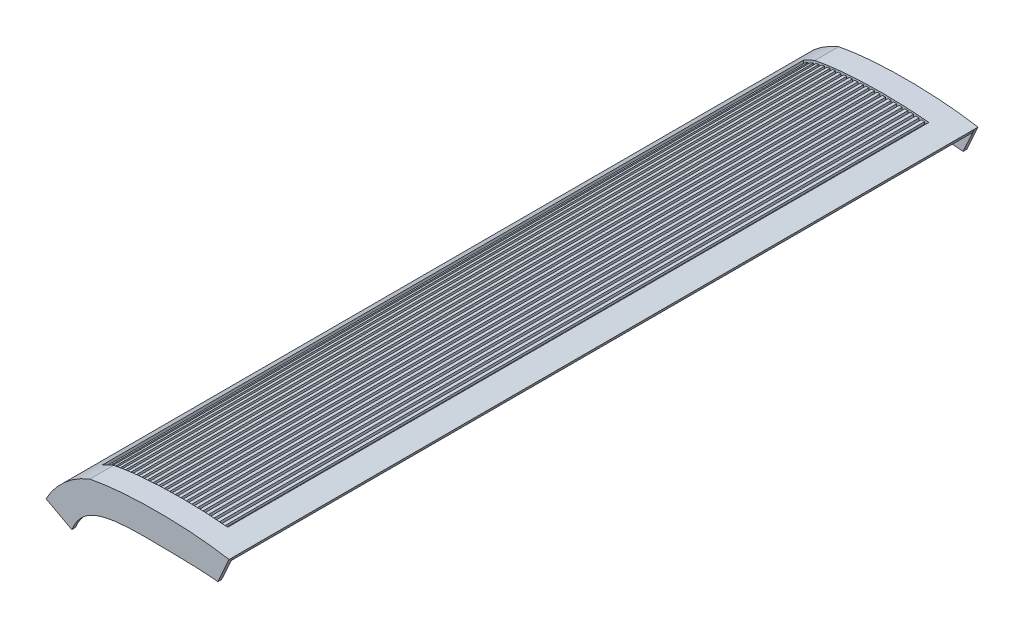
from build123d import *

# Parameters (mm, degrees)
ESTRUSIONE_ESTRUSIONE1_DEPTH  = 734.65
TAGLIO_ESTRUSIONE2_DEPTH      = 769.417610807
SCHIZZO4_W                    = 124.4
SCHIZZO4_H                    = 694.65
TAGLIO_ESTRUSIONE4_DEPTH      = 150
ESTRUSIONE_ESTRUSIONE2_START  = -3.65
ESTRUSIONE_ESTRUSIONE2_DEPTH  = 3.65
ESTRUSIONE_ESTRUSIONE3_DEPTH  = 694.65
TAGLIO_ESTRUSIONE5_REACH      = 777.4
ESTRUSIONE_ESTRUSIONE5_START  = 718.95
ESTRUSIONE_ESTRUSIONE5_DEPTH  = 4
TAGLIO_ESTRUSIONE6_DEPTH      = 4
ESTRUSIONE_ESTRUSIONE8_DEPTH  = 4
ESTRUSIONE_ESTRUSIONE10_START = 15
ESTRUSIONE_ESTRUSIONE10_DEPTH = 4
TAGLIO_ESTRUSIONE7_DEPTH      = 8
ESTRUSIONE_ESTRUSIONE11_DEPTH = 4
ESTRUSIONE_ESTRUSIONE12_START = 364.8
ESTRUSIONE_ESTRUSIONE12_DEPTH = 5
TAGLIO_ESTRUSIONE8_DEPTH      = 5
ESTRUSIONE_ESTRUSIONE13_DEPTH = 5


with BuildPart() as part:
    # Schizzo1 → Estrusione-Estrusione1 (new body)
    with BuildSketch(Plane.XY):
        with BuildLine():
            Line((12.6, 70.4), (17.008835812, 68.04157536))
            ThreePointArc((17.008835812, 68.04157536), (20.932511807, 75.458327557), (26.5, 81.735788961))
            add(Edge.make_bspline(
                [(107.734400105, 104.542752294), (80.106638678, 101.01174599), (49.253448125, 100.153815002), (26.5, 81.735788961)],
                knots=[0, 0, 0, 0, 1, 1, 1, 1], degree=3))
            Line((107.734400105, 104.542752294), (191.734400105, 104.542752294))
            Line((191.734400105, 104.542752294), (194, 109))
            add(Edge.make_bspline(
                [(194, 109), (151.502192325, 116.474922632), (92.222016094, 116.293081601), (56, 109)],
                knots=[0, 0, 0, 0, 1, 1, 1, 1], degree=3))
            ThreePointArc((56, 109), (30.861042629, 93.566599739), (12.6, 70.4))
        make_face()
    extrude(amount=ESTRUSIONE_ESTRUSIONE1_DEPTH)

    # Schizzo2 → Taglio-Estrusione2 (cut, through all)
    with BuildSketch(Plane(origin=(0, 0, 0), x_dir=(-1, 0, 0), z_dir=(0, 0, -1))):
        with BuildLine():
            Line((-107.734400105, 104.542752294), (-191.734400105, 104.542752294))
            Line((-191.734400105, 104.542752294), (-191.960960094, 104.988477064))
            add(Edge.make_bspline(
                [(-191.960960094, 104.988477064), (-159.69978445, 110.70910623), (-111.22857668, 111.841827465), (-58.177617149, 107.879010001), (-37.124424853, 95.517478461), (-25.136316921, 83.040429537)],
                knots=[0, 0, 0, 0, 0.528175519, 0.738646854, 1, 1, 1, 1], degree=3))
            add(Edge.make_bspline(
                [(-25.136316921, 83.040429537), (-20.463853153, 75.880867163), (-16.127068649, 68.513260288)],
                knots=[0, 0, 0, 1, 1, 1], degree=2))
            Line((-16.127068649, 68.513260288), (-17.008835812, 68.04157536))
            Line((-17.008835812, 68.04157536), (-107.734400105, 104.542752294))
        make_face()
    extrude(amount=-TAGLIO_ESTRUSIONE2_DEPTH, mode=Mode.SUBTRACT)

    # Schizzo4 → Taglio-Estrusione4 (cut)
    with BuildSketch(Plane(origin=(0, 0, 0), x_dir=(1, 0, 0), z_dir=(0, 1, 0))):
        with Locations((106.8, -367.325)):
            Rectangle(SCHIZZO4_W, SCHIZZO4_H)
    extrude(amount=TAGLIO_ESTRUSIONE4_DEPTH, mode=Mode.SUBTRACT)

    # Schizzo6 → Estrusione-Estrusione2 (add)
    with BuildSketch(Plane.XY.offset(ESTRUSIONE_ESTRUSIONE2_START)):
        with BuildLine():
            ThreePointArc((25.136316921, 83.040429537), (20.547787769, 75.828879903), (16.127068649, 68.513260288))
            Line((16.127068649, 68.513260288), (38.171247708, 56.721137086))
            add(Edge.make_bspline(
                [(182.9, 84.4), (162.548484893, 85.986053841), (129.902109928, 85.590941508), (70.420343506, 87.306518443), (45.606906259, 73.175039094), (38.171247708, 56.721137086)],
                knots=[0, 0, 0, 0, 0.380128931, 0.71393385, 1, 1, 1, 1], degree=3))
            Line((182.9, 84.4), (194, 109))
            Line((194, 109), (191.960960094, 104.988477064))
            add(Edge.make_bspline(
                [(25.136316921, 83.040429537), (37.124424853, 95.517478461), (58.177617149, 107.879010001), (111.22857668, 111.841827465), (159.69978445, 110.70910623), (191.960960094, 104.988477064)],
                knots=[0, 0, 0, 0, 0.261353146, 0.471824481, 1, 1, 1, 1], degree=3))
        make_face()
        with BuildLine():
            ThreePointArc((56, 109), (30.861042629, 93.566599739), (12.6, 70.4))
            Line((12.6, 70.4), (16.127068649, 68.513260288))
            ThreePointArc((16.127068649, 68.513260288), (20.547787769, 75.828879903), (25.136316921, 83.040429537))
            add(Edge.make_bspline(
                [(25.136316921, 83.040429537), (37.124424853, 95.517478461), (58.177617149, 107.879010001), (111.22857668, 111.841827465), (159.69978445, 110.70910623), (191.960960094, 104.988477064)],
                knots=[0, 0, 0, 0, 0.261353146, 0.471824481, 1, 1, 1, 1], degree=3))
            Line((191.960960094, 104.988477064), (194, 109))
            add(Edge.make_bspline(
                [(194, 109), (151.502192325, 116.474922632), (92.222016094, 116.293081601), (56, 109)],
                knots=[0, 0, 0, 0, 1, 1, 1, 1], degree=3))
        make_face()
    estrusione_estrusione2 = extrude(amount=ESTRUSIONE_ESTRUSIONE2_DEPTH)

    # Specchia1: Estrusione-Estrusione2 across plane
    add(estrusione_estrusione2.mirror(Plane(origin=(0, 0, 367.325), x_dir=(1, 0, 0), z_dir=(0, 0, -1))))

    # Schizzo8 → Estrusione-Estrusione3 (add)
    with BuildSketch(Plane.XY.offset(20)):
        with BuildLine():
            add(Edge.make_bspline(
                [(46.10000001, 102.075729944), (47.078190617, 102.66425108), (48.078995211, 103.211118633), (49.10000001, 103.719786713)],
                knots=[0.014357574, 0.014357574, 0.014357574, 0.014357574, 0.042104262, 0.042104262, 0.042104262, 0.042104262], degree=3))
            Line((46.10000001, 102.075729944), (46.10000001, 97.938998712))
            add(Edge.make_bspline(
                [(46.10000001, 97.938998712), (47.147355804, 98.41106095), (48.146057386, 98.853288802), (49.10000001, 99.267943558)],
                knots=[0.146243585, 0.146243585, 0.146243585, 0.146243585, 0.155879741, 0.155879741, 0.155879741, 0.155879741], degree=3))
            Line((49.10000001, 99.267943558), (49.10000001, 103.719786713))
        make_face()
        with BuildLine():
            add(Edge.make_bspline(
                [(51.60000001, 104.874162222), (52.584660371, 105.294911256), (53.585320287, 105.684622331), (54.60000001, 106.046128457)],
                knots=[0.064407479, 0.064407479, 0.064407479, 0.064407479, 0.090380054, 0.090380054, 0.090380054, 0.090380054], degree=3))
            Line((51.60000001, 104.874162222), (51.60000001, 100.334826866))
            add(Edge.make_bspline(
                [(51.60000001, 100.334826866), (52.657862151, 100.777343762), (53.655572277, 101.182620852), (54.60000001, 101.554646123)],
                knots=[0.164663301, 0.164663301, 0.164663301, 0.164663301, 0.176305534, 0.176305534, 0.176305534, 0.176305534], degree=3))
            Line((54.60000001, 101.554646123), (54.60000001, 106.046128457))
        make_face()
        with BuildLine():
            add(Edge.make_bspline(
                [(57.10000001, 106.872964552), (58.089261053, 107.176136343), (59.089835363, 107.455696593), (60.10000001, 107.714110811)],
                knots=[0.111482891, 0.111482891, 0.111482891, 0.111482891, 0.136280007, 0.136280007, 0.136280007, 0.136280007], degree=3))
            Line((57.10000001, 106.872964552), (57.10000001, 102.508705325))
            add(Edge.make_bspline(
                [(57.10000001, 102.508705325), (58.169471517, 102.902751174), (59.164932088, 103.250170607), (60.10000001, 103.558869377)],
                knots=[0.187122658, 0.187122658, 0.187122658, 0.187122658, 0.20174778, 0.20174778, 0.20174778, 0.20174778], degree=3))
            Line((60.10000001, 103.558869377), (60.10000001, 107.714110811))
        make_face()
        with BuildLine():
            add(Edge.make_bspline(
                [(62.60000001, 108.307765345), (63.592843848, 108.526188353), (64.593366218, 108.726655654), (65.60000001, 108.911409777)],
                knots=[0.15658621, 0.15658621, 0.15658621, 0.15658621, 0.180612046, 0.180612046, 0.180612046, 0.180612046], degree=3))
            Line((62.60000001, 108.307765345), (62.60000001, 104.336787861))
            add(Edge.make_bspline(
                [(62.60000001, 104.336787861), (63.668614399, 104.647955911), (64.659034603, 104.907706587), (65.60000001, 105.132723818)],
                knots=[0.215564929, 0.215564929, 0.215564929, 0.215564929, 0.234324281, 0.234324281, 0.234324281, 0.234324281], degree=3))
            Line((65.60000001, 105.132723818), (65.60000001, 108.911409777))
        make_face()
        with BuildLine():
            add(Edge.make_bspline(
                [(68.10000001, 109.337374659), (69.095858287, 109.494631833), (70.096350723, 109.638558587), (71.10000001, 109.771268943)],
                knots=[0.200409567, 0.200409567, 0.200409567, 0.200409567, 0.223967415, 0.223967415, 0.223967415, 0.223967415], degree=3))
            Line((68.10000001, 109.337374659), (68.10000001, 105.679796553))
            add(Edge.make_bspline(
                [(68.10000001, 105.679796553), (68.553250449, 105.770602802), (69.557807936, 105.962952301), (70.551444712, 106.140786664), (71.10000001, 106.2352491)],
                knots=[0.251626746, 0.251626746, 0.251626746, 0.251626746, 0.261353146, 0.273481208, 0.273481208, 0.273481208, 0.273481208], degree=3))
            Line((71.10000001, 106.2352491), (71.10000001, 109.771268943))
        make_face()
        with BuildLine():
            add(Edge.make_bspline(
                [(73.60000001, 110.079199072), (74.598581398, 110.193711697), (75.59906035, 110.298932813), (76.60000001, 110.396918557)],
                knots=[0.243483293, 0.243483293, 0.243483293, 0.243483293, 0.266824126, 0.266824126, 0.266824126, 0.266824126], degree=3))
            Line((73.60000001, 110.079199072), (73.60000001, 106.640089643))
            add(Edge.make_bspline(
                [(73.60000001, 106.640089643), (74.606151932, 106.792784262), (75.605073124, 106.932151748), (76.60000001, 107.059761944)],
                knots=[0.292040247, 0.292040247, 0.292040247, 0.292040247, 0.314596862, 0.314596862, 0.314596862, 0.314596862], degree=3))
            Line((76.60000001, 107.059761944), (76.60000001, 110.396918557))
        make_face()
        with BuildLine():
            add(Edge.make_bspline(
                [(79.10000001, 110.627782843), (80.101215916, 110.715190707), (81.101695594, 110.797069373), (82.10000001, 110.87547809)],
                knots=[0.286255559, 0.286255559, 0.286255559, 0.286255559, 0.30960817, 0.30960817, 0.30960817, 0.30960817], degree=3))
            Line((79.10000001, 110.627782843), (79.10000001, 107.357307576))
            add(Edge.make_bspline(
                [(79.10000001, 107.357307576), (80.100190775, 107.467344036), (81.099079994, 107.566736267), (82.10000001, 107.657100634)],
                knots=[0.333539265, 0.333539265, 0.333539265, 0.333539265, 0.356316552, 0.356316552, 0.356316552, 0.356316552], degree=3))
            Line((82.10000001, 107.657100634), (82.10000001, 110.87547809))
        make_face()
        with BuildLine():
            add(Edge.make_bspline(
                [(84.60000001, 111.066125055), (85.602769117, 111.14066118), (86.602633438, 111.212799576), (87.60000001, 111.282477116)],
                knots=[0.329143574, 0.329143574, 0.329143574, 0.329143574, 0.352706737, 0.352706737, 0.352706737, 0.352706737], degree=3))
            Line((84.60000001, 111.066125055), (84.60000001, 107.864496334))
            add(Edge.make_bspline(
                [(84.60000001, 107.864496334), (85.594248143, 107.940041876), (86.593177727, 108.008089337), (87.60000001, 108.070196346)],
                knots=[0.37523382, 0.37523382, 0.37523382, 0.37523382, 0.397731791, 0.397731791, 0.397731791, 0.397731791], degree=3))
            Line((87.60000001, 108.070196346), (87.60000001, 111.282477116))
        make_face()
        with BuildLine():
            add(Edge.make_bspline(
                [(90.10000001, 111.452269513), (91.102055197, 111.518348466), (92.10191597, 111.581870078), (93.10000001, 111.642769572)],
                knots=[0.372434034, 0.372434034, 0.372434034, 0.372434034, 0.396200831, 0.396200831, 0.396200831, 0.396200831], degree=3))
            Line((90.10000001, 111.452269513), (90.10000001, 108.212144079))
            add(Edge.make_bspline(
                [(90.10000001, 108.212144079), (91.089162876, 108.263825538), (92.088192255, 108.311140964), (93.10000001, 108.355502772)],
                knots=[0.416220674, 0.416220674, 0.416220674, 0.416220674, 0.437996557, 0.437996557, 0.437996557, 0.437996557], degree=3))
            Line((93.10000001, 108.355502772), (93.10000001, 111.642769572))
        make_face()
        with BuildLine():
            add(Edge.make_bspline(
                [(95.60000001, 111.789986137), (96.601302768, 111.846790243), (97.601161051, 111.900886262), (98.60000001, 111.952208258)],
                knots=[0.416072153, 0.416072153, 0.416072153, 0.416072153, 0.439979768, 0.439979768, 0.439979768, 0.439979768], degree=3))
            Line((95.60000001, 111.789986137), (95.60000001, 108.458810799))
            add(Edge.make_bspline(
                [(95.60000001, 108.458810799), (96.364283773, 108.488720342), (97.360372867, 108.526015513), (98.372159413, 108.562621615), (98.60000001, 108.570797013)],
                knots=[0.455737521, 0.455737521, 0.455737521, 0.455737521, 0.471824481, 0.476479218, 0.476479218, 0.476479218, 0.476479218], degree=3))
            Line((98.60000001, 108.570797013), (98.60000001, 111.952208258))
        make_face()
        with BuildLine():
            add(Edge.make_bspline(
                [(101.10000001, 112.074919435), (102.100525449, 112.121707837), (103.10038241, 112.165649595), (104.10000001, 112.206678159)],
                knots=[0.459940973, 0.459940973, 0.459940973, 0.459940973, 0.483922706, 0.483922706, 0.483922706, 0.483922706], degree=3))
            Line((101.10000001, 112.074919435), (101.10000001, 108.657643408))
            add(Edge.make_bspline(
                [(101.10000001, 108.657643408), (102.08688281, 108.690741472), (103.087121841, 108.722819729), (104.10000001, 108.75351227)],
                knots=[0.493298743, 0.493298743, 0.493298743, 0.493298743, 0.512983566, 0.512983566, 0.512983566, 0.512983566], degree=3))
            Line((104.10000001, 108.75351227), (104.10000001, 112.206678159))
        make_face()
        with BuildLine():
            add(Edge.make_bspline(
                [(106.60000001, 112.3031855), (107.599738413, 112.339318145), (108.599595279, 112.372480794), (109.60000001, 112.402606849)],
                knots=[0.503917132, 0.503917132, 0.503917132, 0.503917132, 0.527904183, 0.527904183, 0.527904183, 0.527904183], degree=3))
            Line((106.60000001, 112.3031855), (106.60000001, 108.825561112))
            add(Edge.make_bspline(
                [(106.60000001, 108.825561112), (107.589156327, 108.852556891), (108.589366199, 108.878008768), (109.60000001, 108.90159547)],
                knots=[0.529018536, 0.529018536, 0.529018536, 0.529018536, 0.547867991, 0.547867991, 0.547867991, 0.547867991], degree=3))
            Line((109.60000001, 108.90159547), (109.60000001, 112.402606849))
        make_face()
        with BuildLine():
            add(Edge.make_bspline(
                [(112.10000001, 112.471500117), (113.099340464, 112.496473532), (114.099363336, 112.51837769), (115.10000001, 112.537167574)],
                knots=[0.547874562, 0.547874562, 0.547874562, 0.547874562, 0.571809471, 0.571809471, 0.571809471, 0.571809471], degree=3))
            Line((112.10000001, 112.471500117), (112.10000001, 108.955543927))
            add(Edge.make_bspline(
                [(112.10000001, 108.955543927), (113.090967195, 108.975147187), (114.091155599, 108.992770248), (115.10000001, 109.008124701)],
                knots=[0.563282713, 0.563282713, 0.563282713, 0.563282713, 0.58146619, 0.58146619, 0.58146619, 0.58146619], degree=3))
            Line((115.10000001, 109.008124701), (115.10000001, 112.537167574))
        make_face()
        with BuildLine():
            add(Edge.make_bspline(
                [(117.60000001, 112.577589802), (118.599468432, 112.591134867), (119.599491158, 112.601541654), (120.60000001, 112.608765433)],
                knots=[0.59173268, 0.59173268, 0.59173268, 0.59173268, 0.615616389, 0.615616389, 0.615616389, 0.615616389], degree=3))
            Line((117.60000001, 112.577589802), (117.60000001, 109.041173631))
            add(Edge.make_bspline(
                [(117.60000001, 109.041173631), (118.592456724, 109.052273972), (119.59262892, 109.061014928), (120.60000001, 109.067132899)],
                knots=[0.596383122, 0.596383122, 0.596383122, 0.596383122, 0.614029464, 0.614029464, 0.614029464, 0.614029464], degree=3))
            Line((120.60000001, 109.067132899), (120.60000001, 112.608765433))
        make_face()
        with BuildLine():
            add(Edge.make_bspline(
                [(123.10000001, 112.620163491), (124.099594698, 112.622052842), (125.09961731, 112.620732718), (126.10000001, 112.616158614)],
                knots=[0.635501627, 0.635501627, 0.635501627, 0.635501627, 0.659345348, 0.659345348, 0.659345348, 0.659345348], degree=3))
            Line((123.10000001, 112.620163491), (123.10000001, 109.07675891))
            add(Edge.make_bspline(
                [(123.10000001, 109.07675891), (124.093716032, 109.078343663), (125.09387579, 109.077227079), (126.10000001, 109.073164599)],
                knots=[0.628543516, 0.628543516, 0.628543516, 0.628543516, 0.645754308, 0.645754308, 0.645754308, 0.645754308], degree=3))
            Line((126.10000001, 109.073164599), (126.10000001, 112.616158614))
        make_face()
        with BuildLine():
            add(Edge.make_bspline(
                [(128.60000001, 112.59793518), (129.599719683, 112.587922702), (130.599742213, 112.57462717), (131.60000001, 112.558004243)],
                knots=[0.679201874, 0.679201874, 0.679201874, 0.679201874, 0.703016636, 0.703016636, 0.703016636, 0.703016636], degree=3))
            Line((128.60000001, 112.59793518), (128.60000001, 109.056975984))
            add(Edge.make_bspline(
                [(128.60000001, 109.056975984), (129.594806806, 109.048076888), (130.594956937, 109.036158054), (131.60000001, 109.020989663)],
                knots=[0.659941536, 0.659941536, 0.659941536, 0.659941536, 0.676799429, 0.676799429, 0.676799429, 0.676799429], degree=3))
            Line((131.60000001, 109.020989663), (131.60000001, 112.558004243))
        make_face()
        with BuildLine():
            add(Edge.make_bspline(
                [(134.10000001, 112.50951349), (135.099843793, 112.487333402), (136.099866272, 112.461794083), (137.10000001, 112.432851292)],
                knots=[0.722853579, 0.722853579, 0.722853579, 0.722853579, 0.746650275, 0.746650275, 0.746650275, 0.746650275], degree=3))
            Line((134.10000001, 112.50951349), (134.10000001, 108.976626858))
            add(Edge.make_bspline(
                [(134.10000001, 108.976626858), (135.095772623, 108.956282239), (136.0959153, 108.932613045), (137.10000001, 108.905400864)],
                knots=[0.690722618, 0.690722618, 0.690722618, 0.690722618, 0.707296796, 0.707296796, 0.707296796, 0.707296796], degree=3))
            Line((137.10000001, 108.905400864), (137.10000001, 112.432851292))
        make_face()
        with BuildLine():
            add(Edge.make_bspline(
                [(139.60000001, 112.353396399), (140.599967428, 112.318762199), (141.599989886, 112.280689761), (142.60000001, 112.239134885)],
                knots=[0.766476674, 0.766476674, 0.766476674, 0.766476674, 0.790266116, 0.790266116, 0.790266116, 0.790266116], degree=3))
            Line((139.60000001, 112.353396399), (139.60000001, 108.830460924))
            add(Edge.make_bspline(
                [(139.60000001, 108.830460924), (140.596645496, 108.797686267), (141.59678246, 108.761288001), (142.60000001, 108.721056463)],
                knots=[0.721009218, 0.721009218, 0.721009218, 0.721009218, 0.737359156, 0.737359156, 0.737359156, 0.737359156], degree=3))
            Line((142.60000001, 108.721056463), (142.60000001, 112.239134885))
        make_face()
        with BuildLine():
            add(Edge.make_bspline(
                [(145.10000001, 112.127965168), (146.100090979, 112.080568416), (147.100113447, 112.029651346), (148.10000001, 111.975169738)],
                knots=[0.810090963, 0.810090963, 0.810090963, 0.810090963, 0.833883931, 0.833883931, 0.833883931, 0.833883931], degree=3))
            Line((145.10000001, 112.127965168), (145.10000001, 108.613029913))
            add(Edge.make_bspline(
                [(145.10000001, 108.613029913), (146.09744987, 108.566792629), (147.097582563, 108.516632092), (148.10000001, 108.462345178)],
                knots=[0.750907204, 0.750907204, 0.750907204, 0.750907204, 0.767085363, 0.767085363, 0.767085363, 0.767085363], degree=3))
            Line((148.10000001, 108.462345178), (148.10000001, 111.975169738))
        make_face()
        with BuildLine():
            add(Edge.make_bspline(
                [(150.60000001, 111.831477369), (151.60021484, 111.77098631), (152.600237349, 111.706889515), (153.60000001, 111.639142683)],
                knots=[0.85371621, 0.85371621, 0.85371621, 0.85371621, 0.877523498, 0.877523498, 0.877523498, 0.877523498], degree=3))
            Line((150.60000001, 111.831477369), (150.60000001, 108.318557925))
            add(Edge.make_bspline(
                [(150.60000001, 108.318557925), (151.59820517, 108.257753619), (152.598334827, 108.192720131), (153.60000001, 108.12325898)],
                knots=[0.780510481, 0.780510481, 0.780510481, 0.780510481, 0.79656432, 0.79656432, 0.79656432, 0.79656432], degree=3))
            Line((153.60000001, 108.12325898), (153.60000001, 111.639142683))
        make_face()
        with BuildLine():
            add(Edge.make_bspline(
                [(156.10000001, 111.46205896), (157.100339406, 111.388116953), (158.100361986, 111.31048017), (159.10000001, 111.229104168)],
                knots=[0.897372227, 0.897372227, 0.897372227, 0.897372227, 0.921204697, 0.921204697, 0.921204697, 0.921204697], degree=3))
            Line((156.10000001, 111.46205896), (156.10000001, 107.940814093))
            add(Edge.make_bspline(
                [(156.10000001, 107.940814093), (157.098927522, 107.864242321), (158.099055243, 107.78312378), (159.10000001, 107.697262955)],
                knots=[0.809904478, 0.809904478, 0.809904478, 0.809904478, 0.825878027, 0.825878027, 0.825878027, 0.825878027], degree=3))
            Line((159.10000001, 107.697262955), (159.10000001, 111.229104168))
        make_face()
        with BuildLine():
            add(Edge.make_bspline(
                [(161.60000001, 111.017695283), (162.600465079, 110.929919024), (163.600487762, 110.838355017), (164.60000001, 110.742958619)],
                knots=[0.941078968, 0.941078968, 0.941078968, 0.941078968, 0.964947594, 0.964947594, 0.964947594, 0.964947594], degree=3))
            Line((161.60000001, 111.017695283), (161.60000001, 107.472978028))
            add(Edge.make_bspline(
                [(161.60000001, 107.472978028), (162.599630972, 107.3793158), (163.599757775, 107.280772155), (164.60000001, 107.177152983)],
                knots=[0.839168901, 0.839168901, 0.839168901, 0.839168901, 0.855104061, 0.855104061, 0.855104061, 0.855104061], degree=3))
            Line((164.60000001, 107.177152983), (164.60000001, 110.742958619))
        make_face()
        with BuildLine():
            add(Edge.make_bspline(
                [(166.60000001, 110.546874027), (167.266921252, 110.479747659), (167.933594672, 110.410899328), (168.60000001, 110.340315743)],
                knots=[0.980873364, 0.980873364, 0.980873364, 0.980873364, 0.996810971, 0.996810971, 0.996810971, 0.996810971], degree=3))
            Line((166.60000001, 110.546874027), (166.60000001, 106.963147816))
            add(Edge.make_bspline(
                [(166.60000001, 106.963147816), (167.26676561, 106.889506288), (167.933469838, 106.813551835), (168.60000001, 106.735226958)],
                knots=[0.865724709, 0.865724709, 0.865724709, 0.865724709, 0.876347313, 0.876347313, 0.876347313, 0.876347313], degree=3))
            Line((168.60000001, 106.735226958), (168.60000001, 110.340315743))
        make_face()
    extrude(amount=ESTRUSIONE_ESTRUSIONE3_DEPTH)

    # Taglio-Estrusione5: up to this face of the body (flat: up to its plane)
    taglio_estrusione5_end = Plane(part.part.faces().sort_by_distance((100.600951379, 94.723507219, -3.65))[0])
    # Schizzo9 → Taglio-Estrusione5 (cut, up to the picked face)
    with BuildSketch(Plane.XY.offset(738.3), mode=Mode.PRIVATE) as taglio_estrusione5_sk1:
        with BuildLine():
            add(Edge.make_bspline(
                [(38.171247708, 56.721137086), (45.05902945, 73.821016737), (70.988744913, 87.670922677), (130.154860637, 86.347718811), (162.243789984, 86.453808975), (182.9, 84.4)],
                knots=[0, 0, 0, 0, 0.28606615, 0.619871069, 1, 1, 1, 1], degree=3))
            add(Edge.make_bspline(
                [(38.171247708, 56.721137086), (45.606906259, 73.175039094), (70.420343506, 87.306518443), (129.902109928, 85.590941508), (162.548484893, 85.986053841), (182.9, 84.4)],
                knots=[0, 0, 0, 0, 0.28606615, 0.619871069, 1, 1, 1, 1], degree=3))
        make_face()
    taglio_estrusione5_tool1 = split(extrude(taglio_estrusione5_sk1.sketch, amount=-TAGLIO_ESTRUSIONE5_REACH, mode=Mode.PRIVATE), bisect_by=taglio_estrusione5_end, keep=Keep.BOTH, mode=Mode.PRIVATE)
    add(taglio_estrusione5_tool1.solids().sort_by(Axis((104.730129, 86.588646, 738.3), (0, 0, -1)))[0], mode=Mode.SUBTRACT)

    # Estrusione-Estrusione5: read off the stored shape, not the designer's step
    # Estrusione-Estrusione5 outline → Estrusione-Estrusione5 (add)
    with BuildSketch(Plane.XY.offset(ESTRUSIONE_ESTRUSIONE5_START)):
        with BuildLine():
            Line((168.260960094, 108.314624021), (168.260960094, 100.314624021))
            add(Edge.make_bspline(
                [(168.260960094, 100.314624021), (170.598511999, 100.065771904), (172.932691736, 99.795720177), (175.260960094, 99.503461558)],
                knots=[0.8724042, 0.8724042, 0.8724042, 0.8724042, 0.909814059, 0.909814059, 0.909814059, 0.909814059], degree=3))
            Line((175.260960094, 99.503461558), (175.260960094, 107.503461558))
            add(Edge.make_bspline(
                [(168.260960094, 108.314624021), (170.598511999, 108.065771904), (172.932691736, 107.795720177), (175.260960094, 107.503461558)],
                knots=[0.8724042, 0.8724042, 0.8724042, 0.8724042, 0.909814059, 0.909814059, 0.909814059, 0.909814059], degree=3))
        make_face()
    extrude(amount=ESTRUSIONE_ESTRUSIONE5_DEPTH)

    # Schizzo11 → Taglio-Estrusione6 (cut)
    with BuildSketch(Plane(origin=(0, 0, 718.95), x_dir=(-1, 0, 0), z_dir=(0, 0, -1))):
        Polygon((-175.260960094, 99.503461558), (-169.360960094, 100.195922722), (-175.260960094, 107.503461558), align=None)
    extrude(amount=-TAGLIO_ESTRUSIONE6_DEPTH, mode=Mode.SUBTRACT)

    # Schizzo12 → Estrusione-Estrusione8 (add)
    with BuildSketch(Plane(origin=(0, 0, 718.95), x_dir=(-1, 0, 0), z_dir=(0, 0, -1))):
        with BuildLine():
            Line((-168.260960094, 100.314624021), (-168.260960094, 98.564624021))
            ThreePointArc((-168.260960094, 98.564624021), (-168.407406704, 98.21107063), (-168.760960094, 98.064624021))
            ThreePointArc((-168.760960094, 98.064624021), (-169.66869732, 98.562008406), (-170.019224069, 99.535922722))
            Line((-170.019224069, 99.535922722), (-169.519546419, 99.535922722))
            ThreePointArc((-169.519546419, 99.535922722), (-169.402317075, 99.702098118), (-169.360960094, 99.90121261))
            Line((-169.360960094, 99.90121261), (-169.360960094, 100.195922722))
            Line((-169.360960094, 100.195922722), (-175.260960094, 107.503461558))
            Line((-175.260960094, 107.503461558), (-168.260960094, 108.314624021))
            Line((-168.260960094, 108.314624021), (-168.260960094, 100.314624021))
        make_face()
    extrude(amount=-ESTRUSIONE_ESTRUSIONE8_DEPTH)

    # Estrusione-Estrusione10: read off the stored shape, not the designer's step
    # Estrusione-Estrusione10 outline → Estrusione-Estrusione10 (add)
    with BuildSketch(Plane.XY.offset(ESTRUSIONE_ESTRUSIONE10_START)):
        with BuildLine():
            Line((168.260960094, 108.314624021), (168.260960094, 100.314624021))
            add(Edge.make_bspline(
                [(168.260960094, 100.314624021), (170.598511999, 100.065771904), (172.932691736, 99.795720177), (175.260960094, 99.503461558)],
                knots=[0.8724042, 0.8724042, 0.8724042, 0.8724042, 0.909814059, 0.909814059, 0.909814059, 0.909814059], degree=3))
            Line((175.260960094, 99.503461558), (175.260960094, 107.503461558))
            add(Edge.make_bspline(
                [(168.260960094, 108.314624021), (170.598511999, 108.065771904), (172.932691736, 107.795720177), (175.260960094, 107.503461558)],
                knots=[0.8724042, 0.8724042, 0.8724042, 0.8724042, 0.909814059, 0.909814059, 0.909814059, 0.909814059], degree=3))
        make_face()
    extrude(amount=ESTRUSIONE_ESTRUSIONE10_DEPTH)

    # Schizzo15 → Taglio-Estrusione7 (cut)
    with BuildSketch(Plane.XY.offset(19)):
        Polygon((175.260960094, 99.503461558), (175.260960094, 107.503461558), (169.370960094, 100.194828916), align=None)
    extrude(amount=-TAGLIO_ESTRUSIONE7_DEPTH, mode=Mode.SUBTRACT)

    # Schizzo17 → Estrusione-Estrusione11 (add)
    with BuildSketch(Plane(origin=(0, 0, 15), x_dir=(-1, 0, 0), z_dir=(0, 0, -1))):
        with BuildLine():
            Line((-168.260960094, 100.314624021), (-168.260960094, 98.564624021))
            ThreePointArc((-168.260960094, 98.564624021), (-168.407406704, 98.21107063), (-168.760960094, 98.064624021))
            ThreePointArc((-168.760960094, 98.064624021), (-169.677399658, 98.557863736), (-170.033134826, 99.535922722))
            Line((-170.033134826, 99.535922722), (-169.533457176, 99.535922722))
            ThreePointArc((-169.533457176, 99.535922722), (-169.413384166, 99.703274282), (-169.370960094, 99.904828916))
            Line((-169.370960094, 99.904828916), (-169.370960094, 100.194828916))
            Line((-169.370960094, 100.194828916), (-175.260960094, 107.503461558))
            Line((-175.260960094, 107.503461558), (-168.260960094, 108.314624021))
            Line((-168.260960094, 108.314624021), (-168.260960094, 100.314624021))
        make_face()
    extrude(amount=-ESTRUSIONE_ESTRUSIONE11_DEPTH)

    # Estrusione-Estrusione12: read off the stored shape, not the designer's step
    # Estrusione-Estrusione12 outline → Estrusione-Estrusione12 (add)
    with BuildSketch(Plane.XY.offset(ESTRUSIONE_ESTRUSIONE12_START)):
        with BuildLine():
            Line((171.860960094, 107.914127409), (171.860960094, 99.914127409))
            add(Edge.make_bspline(
                [(171.860960094, 99.914127409), (173.697603594, 99.700898958), (175.531349667, 99.474215998), (177.360960097, 99.233587341)],
                knots=[0.891624918, 0.891624918, 0.891624918, 0.891624918, 0.921070401, 0.921070401, 0.921070401, 0.921070401], degree=3))
            Line((177.360960097, 99.233587341), (177.360960094, 107.233587341))
            add(Edge.make_bspline(
                [(171.860960094, 107.914127409), (173.697603593, 107.700898958), (175.531349665, 107.474215999), (177.360960094, 107.233587341)],
                knots=[0.891624918, 0.891624918, 0.891624918, 0.891624918, 0.921070401, 0.921070401, 0.921070401, 0.921070401], degree=3))
        make_face()
    extrude(amount=ESTRUSIONE_ESTRUSIONE12_DEPTH)

    # Schizzo19 → Taglio-Estrusione8 (cut)
    with BuildSketch(Plane.XY.offset(369.8)):
        Polygon((177.360960096, 99.233587341), (177.360960096, 107.233587341), (175.360960097, 104.45817833), (175.360960097, 101.291056456), (171.860960097, 101.724127409), (171.860960097, 99.914127409), align=None)
    extrude(amount=-TAGLIO_ESTRUSIONE8_DEPTH, mode=Mode.SUBTRACT)

    # Schizzo20 → Estrusione-Estrusione13 (add)
    with BuildSketch(Plane.XY.offset(369.8)):
        with BuildLine():
            Line((171.860960094, 101.724127409), (171.860960094, 99.724127409))
            ThreePointArc((171.860960094, 99.724127409), (172.300299922, 98.663467237), (173.360960094, 98.224127409))
            Line((173.360960094, 98.224127409), (177.417440349, 98.224127409))
            ThreePointArc((177.417440349, 98.224127409), (178.23148283, 98.968285686), (178.789436788, 99.91966578))
            ThreePointArc((178.789436788, 99.91966578), (178.689027328, 100.851685266), (177.860960097, 101.291056456))
            Line((177.860960097, 101.291056456), (175.360960097, 101.291056456))
            Line((175.360960097, 101.291056456), (175.360960097, 104.45817833))
            Line((175.360960097, 104.45817833), (177.360960097, 107.233587341))
            Line((177.360960097, 107.233587341), (171.860960097, 107.914127409))
            Line((171.860960097, 107.914127409), (171.860960094, 101.724127409))
        make_face()
    extrude(amount=-ESTRUSIONE_ESTRUSIONE13_DEPTH)


solid = part.part
